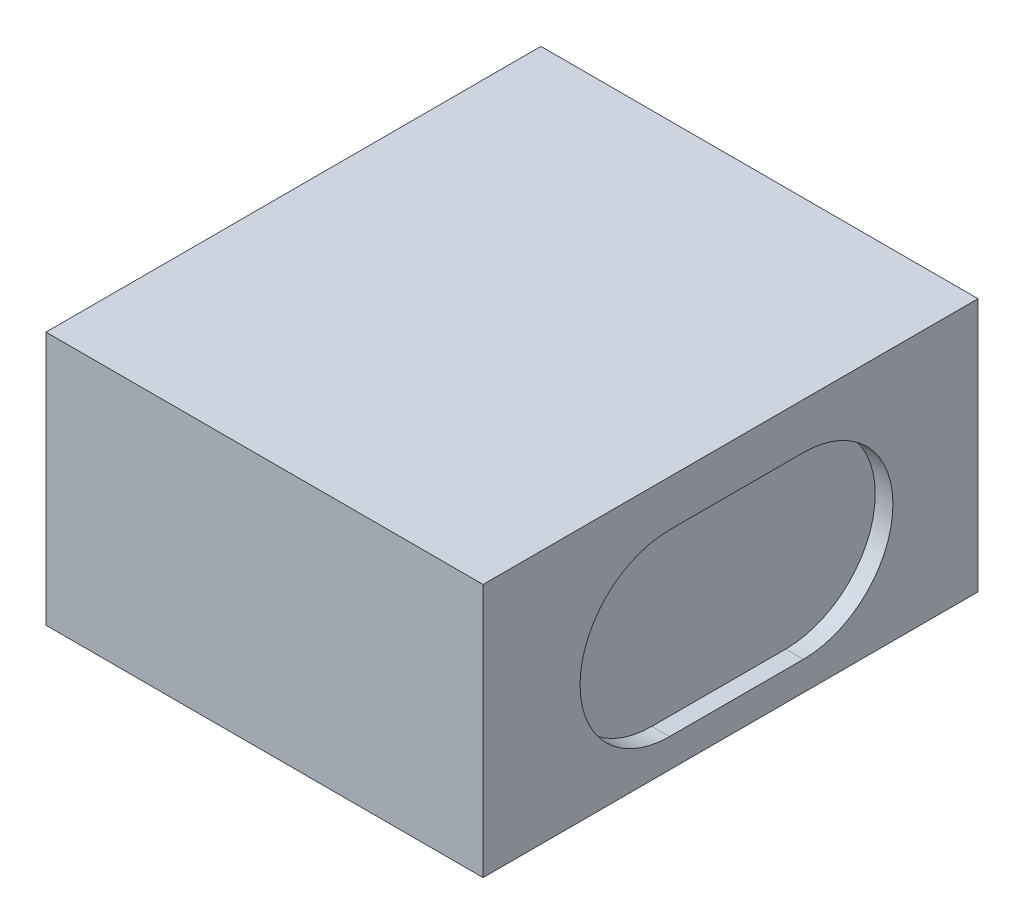
from build123d import *

# Parameters (mm, degrees)
SKETCH1_W           = 6.8
SKETCH1_H           = 7.7
BOSS_EXTRUDE1_DEPTH = 3.95
CUT_EXTRUDE4_START  = -0.275354201
CUT_EXTRUDE4_DEPTH  = 0.275354201


# Read off the part's stored shape, not the designer's step: Cut-Extrude4
with BuildPart() as part:
    # Sketch1 → Boss-Extrude1 (new body)
    with BuildSketch(Plane(origin=(0, 0, 0), x_dir=(1, 0, 0), z_dir=(0, 1, 0))):
        with Locations((3.4, 3.85)):
            Rectangle(SKETCH1_W, SKETCH1_H)
    extrude(amount=BOSS_EXTRUDE1_DEPTH)

    # Cut-Extrude4 outline → Cut-Extrude4 (cut)
    with BuildSketch(Plane(origin=(6.8, 0, 0), x_dir=(0, 0, -1), z_dir=(1, 0, 0)).offset(CUT_EXTRUDE4_START)):
        with BuildLine():
            Line((4.98352639, 3.235480271), (2.901682517, 3.235480271))
            ThreePointArc((2.901682517, 3.235480271), (1.50879417, 1.842591924), (2.901682517, 0.449703578))
            Line((2.901682517, 0.449703578), (4.98352639, 0.449703578))
            ThreePointArc((4.98352639, 0.449703578), (6.376414736, 1.842591924), (4.98352639, 3.235480271))
        make_face()
    extrude(amount=CUT_EXTRUDE4_DEPTH, mode=Mode.SUBTRACT)


solid = part.part
